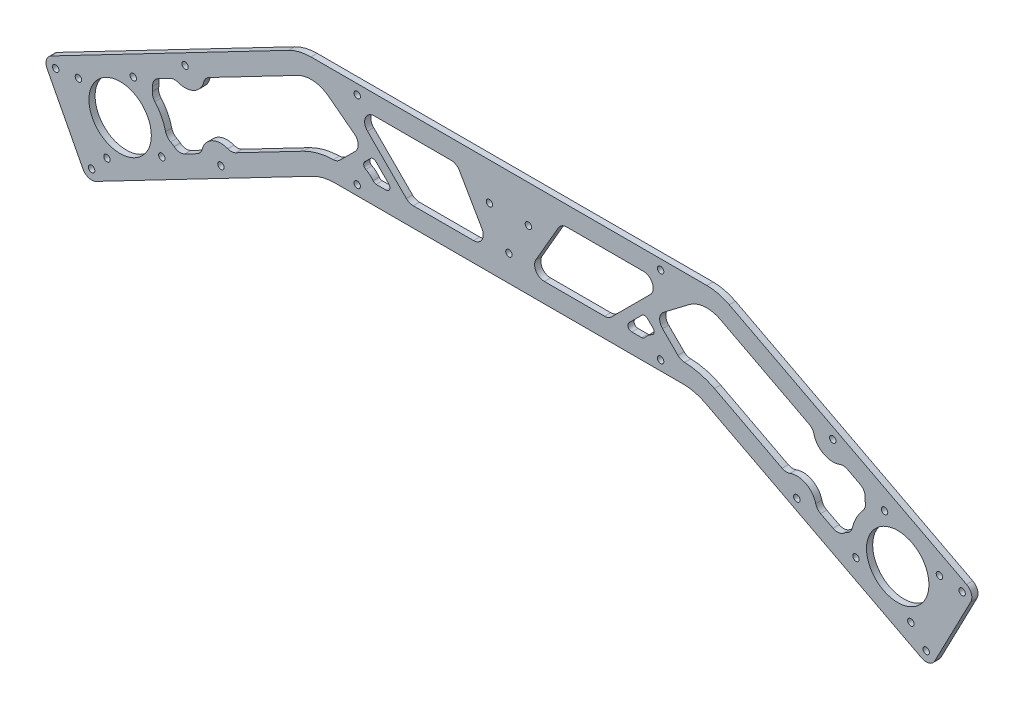
from build123d import *

# Parameters (mm, degrees)
SKETCH1_R              = 16.05
SKETCH1_R_2            = 1.65
BASE_DEPTH             = 3.175
SKETCH3_R              = 1.65
STRUT_HOLES_DEPTH      = 276.893827895
LIGHTENING_HOLES_DEPTH = 276.893827895


with BuildPart() as part:
    # Sketch1 → Base (new body)
    with BuildSketch(Plane.XY):
        with BuildLine():
            Line((-113.35576806, -30.824729171), (-235.437134887, -94.376266227))
            ThreePointArc((-235.437134887, -94.376266227), (-237.896976574, -97.307791395), (-237.563445987, -101.120063459))
            Line((-237.563445987, -101.120063459), (-219.093501457, -136.600496786))
            ThreePointArc((-219.093501457, -136.600496786), (-216.161976289, -139.060338474), (-212.349704225, -138.726807886))
            Line((-212.349704225, -138.726807886), (-101.120845899, -80.824729171))
            ThreePointArc((-101.120845899, -80.824729171), (-95.519277876, -78.716448255), (-89.577130568, -78))
            Line((-89.577130568, -78), (89.577130568, -78))
            ThreePointArc((89.577130568, -78), (95.519277876, -78.716448255), (101.120845899, -80.824729171))
            Line((101.120845899, -80.824729171), (212.349704225, -138.726807886))
            ThreePointArc((212.349704225, -138.726807886), (216.161976289, -139.060338474), (219.093501457, -136.600496786))
            Line((219.093501457, -136.600496786), (237.563445987, -101.120063459))
            ThreePointArc((237.563445987, -101.120063459), (237.896976574, -97.307791395), (235.437134887, -94.376266227))
            Line((235.437134887, -94.376266227), (113.35576806, -30.824729171))
            ThreePointArc((113.35576806, -30.824729171), (107.754200038, -28.716448255), (101.812052729, -28))
            Line((101.812052729, -28), (-101.812052729, -28))
            ThreePointArc((-101.812052729, -28), (-107.754200038, -28.716448255), (-113.35576806, -30.824729171))
        make_face()
        with Locations((-200, -104.11341011)):
            Circle(SKETCH1_R, mode=Mode.SUBTRACT)
        with Locations((-221.458631392, -97.347529622)):
            Circle(SKETCH1_R_2, mode=Mode.SUBTRACT)
        with Locations((-193.234119511, -82.654778719)):
            Circle(SKETCH1_R_2, mode=Mode.SUBTRACT)
        with Locations((-178.541368608, -110.879290599)):
            Circle(SKETCH1_R_2, mode=Mode.SUBTRACT)
        with Locations((-206.765880489, -125.572041502)):
            Circle(SKETCH1_R_2, mode=Mode.SUBTRACT)
        with Locations((206.765880489, -125.572041502)):
            Circle(SKETCH1_R_2, mode=Mode.SUBTRACT)
        with Locations((221.458631392, -97.347529622)):
            Circle(SKETCH1_R_2, mode=Mode.SUBTRACT)
        with Locations((193.234119511, -82.654778719)):
            Circle(SKETCH1_R_2, mode=Mode.SUBTRACT)
        with Locations((178.541368608, -110.879290599)):
            Circle(SKETCH1_R_2, mode=Mode.SUBTRACT)
        with Locations((200, -104.11341011)):
            Circle(SKETCH1_R, mode=Mode.SUBTRACT)
        with Locations((-10, -47.226497308)):
            Circle(SKETCH1_R_2, mode=Mode.SUBTRACT)
        with Locations((10, -47.226497308)):
            Circle(SKETCH1_R_2, mode=Mode.SUBTRACT)
        with Locations((0, -64.547005384)):
            Circle(SKETCH1_R_2, mode=Mode.SUBTRACT)
    extrude(amount=BASE_DEPTH)

    # Sketch3 → Strut Holes (cut, through all)
    with BuildSketch(Plane.XY.offset(3.175)):
        with Locations((-214.658447291, -134.29175372)):
            Circle(SKETCH3_R)
        with Locations((-148.132634803, -99.660607727)):
            Circle(SKETCH3_R)
        with Locations((-78.03119405, -73)):
            Circle(SKETCH3_R)
        with Locations((-78.03119405, -33)):
            Circle(SKETCH3_R)
        with Locations((-166.602579332, -64.1801744)):
            Circle(SKETCH3_R)
        with Locations((-233.128391821, -98.811320393)):
            Circle(SKETCH3_R)
        with Locations((233.128391821, -98.811320393)):
            Circle(SKETCH3_R)
        with Locations((166.602579332, -64.1801744)):
            Circle(SKETCH3_R)
        with Locations((78.03119405, -33)):
            Circle(SKETCH3_R)
        with Locations((78.03119405, -73)):
            Circle(SKETCH3_R)
        with Locations((148.132634803, -99.660607727)):
            Circle(SKETCH3_R)
        with Locations((214.658447291, -134.29175372)):
            Circle(SKETCH3_R)
    extrude(amount=-STRUT_HOLES_DEPTH, mode=Mode.SUBTRACT)

    # Sketch4 → Lightening Holes (cut, through all)
    with BuildSketch(Plane(origin=(0, 0, 0), x_dir=(-1, 0, 0), z_dir=(0, 0, -1))):
        with BuildLine():
            Line((-166.732564066, -103.70620831), (-160.358460468, -100.38806))
            ThreePointArc((-160.358460468, -100.38806), (-158.749015825, -99.059097441), (-157.82234729, -97.188873132))
            ThreePointArc((-157.82234729, -97.188873132), (-152.750120935, -90.790499395), (-144.599570492, -90.305531214))
            ThreePointArc((-144.599570492, -90.305531214), (-142.53605719, -90.619165384), (-140.52429527, -90.063047123))
            Line((-140.52429527, -90.063047123), (-105.738332031, -71.954620839))
            ThreePointArc((-105.738332031, -71.954620839), (-98.269905543, -69.096671797), (-90.347714306, -68.008483875))
            ThreePointArc((-90.347714306, -68.008483875), (-88.493641512, -67.607748759), (-86.922263791, -66.545229763))
            Line((-86.922263791, -66.545229763), (-79.009491694, -58.632457666))
            ThreePointArc((-79.009491694, -58.632457666), (-77.556385787, -54.760066484), (-79.516892411, -51.11817906))
            Line((-79.516892411, -51.11817906), (-92.727653164, -41.063765898))
            ThreePointArc((-92.727653164, -41.063765898), (-100.534196684, -38.054529652), (-108.738281928, -39.694837502))
            Line((-108.738281928, -39.694837502), (-154.376753667, -63.452722127))
            ThreePointArc((-154.376753667, -63.452722127), (-155.986198311, -64.781684686), (-156.912866845, -66.651908996))
            ThreePointArc((-156.912866845, -66.651908996), (-161.9850932, -73.050282732), (-170.135643643, -73.535250914))
            ThreePointArc((-170.135643643, -73.535250914), (-172.199156946, -73.221616743), (-174.210918865, -73.777735004))
            Line((-174.210918865, -73.777735004), (-180.585022463, -77.095883315))
            ThreePointArc((-180.585022463, -77.095883315), (-182.645072259, -79.099137955), (-183.262226102, -81.905551227))
            ThreePointArc((-183.262226102, -81.905551227), (-183.239750678, -82.990325484), (-183.334932996, -84.071149549))
            ThreePointArc((-183.334932996, -84.071149549), (-183.171057415, -86.227404823), (-182.1120053, -88.112796196))
            ThreePointArc((-182.1120053, -88.112796196), (-178.711740004, -93.031443393), (-176.632932149, -98.637997792))
            ThreePointArc((-176.632932149, -98.637997792), (-175.695957289, -100.586938562), (-174.023651545, -101.957954795))
            ThreePointArc((-174.023651545, -101.957954795), (-173.083697968, -102.499921221), (-172.207994291, -103.140532962))
            ThreePointArc((-172.207994291, -103.140532962), (-169.555130221, -104.244682653), (-166.732564066, -103.70620831))
        make_face()
        with BuildLine():
            Line((-68.284399705, -68), (-63.199367137, -68))
            ThreePointArc((-63.199367137, -68), (-61.351608072, -66.765366865), (-61.785153575, -64.585786438))
            Line((-61.785153575, -64.585786438), (-68.424239552, -57.946700461))
            ThreePointArc((-68.424239552, -57.946700461), (-69.838453114, -57.360914023), (-71.252666676, -57.946700461))
            Line((-71.252666676, -57.946700461), (-74.132142401, -60.826176185))
            ThreePointArc((-74.132142401, -60.826176185), (-74.691303243, -62.565648815), (-73.60347304, -64.033658123))
            ThreePointArc((-73.60347304, -64.033658123), (-71.563592326, -65.373065627), (-69.908865429, -67.166666667))
            ThreePointArc((-69.908865429, -67.166666667), (-69.197270634, -67.779513042), (-68.284399705, -68))
        make_face()
        with BuildLine():
            Line((-25.430550415, -40.5), (-13.883545032, -60.5))
            ThreePointArc((-13.883545032, -60.5), (-13.883545032, -65.5), (-18.21367205, -68))
            Line((-18.21367205, -68), (-49.228804389, -68))
            ThreePointArc((-49.228804389, -68), (-51.14222155, -67.619397663), (-52.764338294, -66.535533906))
            Line((-52.764338294, -66.535533906), (-72.764338294, -46.535533906))
            ThreePointArc((-72.764338294, -46.535533906), (-73.848202051, -41.086582838), (-69.228804389, -38))
            Line((-69.228804389, -38), (-29.760677434, -38))
            ThreePointArc((-29.760677434, -38), (-27.260677434, -38.669872981), (-25.430550415, -40.5))
        make_face()
        with BuildLine():
            Line((52.764338294, -66.535533906), (72.764338294, -46.535533906))
            ThreePointArc((72.764338294, -46.535533906), (73.848202051, -41.086582838), (69.228804389, -38))
            Line((69.228804389, -38), (29.760677434, -38))
            ThreePointArc((29.760677434, -38), (27.260677434, -38.669872981), (25.430550415, -40.5))
            Line((25.430550415, -40.5), (13.883545032, -60.5))
            ThreePointArc((13.883545032, -60.5), (13.883545032, -65.5), (18.21367205, -68))
            Line((18.21367205, -68), (49.228804389, -68))
            ThreePointArc((49.228804389, -68), (51.14222155, -67.619397663), (52.764338294, -66.535533906))
        make_face()
        with BuildLine():
            Line((68.284399705, -68), (63.199367137, -68))
            ThreePointArc((63.199367137, -68), (61.351608072, -66.765366865), (61.785153575, -64.585786438))
            Line((61.785153575, -64.585786438), (68.424239552, -57.946700461))
            ThreePointArc((68.424239552, -57.946700461), (69.838453114, -57.360914023), (71.252666676, -57.946700461))
            Line((71.252666676, -57.946700461), (74.132142401, -60.826176185))
            ThreePointArc((74.132142401, -60.826176185), (74.691303243, -62.565648815), (73.60347304, -64.033658123))
            ThreePointArc((73.60347304, -64.033658123), (71.563592326, -65.373065627), (69.908865429, -67.166666667))
            ThreePointArc((69.908865429, -67.166666667), (69.197270634, -67.779513042), (68.284399705, -68))
        make_face()
        with BuildLine():
            Line((154.376753667, -63.452722127), (108.738281928, -39.694837502))
            ThreePointArc((108.738281928, -39.694837502), (100.534196684, -38.054529652), (92.727653164, -41.063765898))
            Line((92.727653164, -41.063765898), (79.516892411, -51.11817906))
            ThreePointArc((79.516892411, -51.11817906), (77.556385787, -54.760066484), (79.009491694, -58.632457666))
            Line((79.009491694, -58.632457666), (86.922263791, -66.545229763))
            ThreePointArc((86.922263791, -66.545229763), (88.493641512, -67.607748759), (90.347714306, -68.008483875))
            ThreePointArc((90.347714306, -68.008483875), (98.269905543, -69.096671797), (105.738332031, -71.954620839))
            Line((105.738332031, -71.954620839), (140.52429527, -90.063047123))
            ThreePointArc((140.52429527, -90.063047123), (142.53605719, -90.619165384), (144.599570492, -90.305531214))
            ThreePointArc((144.599570492, -90.305531214), (152.750120935, -90.790499395), (157.82234729, -97.188873132))
            ThreePointArc((157.82234729, -97.188873132), (158.749015825, -99.059097441), (160.358460468, -100.38806))
            Line((160.358460468, -100.38806), (166.732564066, -103.70620831))
            ThreePointArc((166.732564066, -103.70620831), (169.555130221, -104.244682653), (172.207994291, -103.140532962))
            ThreePointArc((172.207994291, -103.140532962), (173.083697968, -102.499921221), (174.023651545, -101.957954795))
            ThreePointArc((174.023651545, -101.957954795), (175.695957289, -100.586938562), (176.632932149, -98.637997792))
            ThreePointArc((176.632932149, -98.637997792), (178.711740004, -93.031443393), (182.1120053, -88.112796196))
            ThreePointArc((182.1120053, -88.112796196), (183.171057415, -86.227404823), (183.334932996, -84.071149549))
            ThreePointArc((183.334932996, -84.071149549), (183.239750678, -82.990325484), (183.262226102, -81.905551227))
            ThreePointArc((183.262226102, -81.905551227), (182.645072259, -79.099137955), (180.585022463, -77.095883315))
            Line((180.585022463, -77.095883315), (174.210918865, -73.777735004))
            ThreePointArc((174.210918865, -73.777735004), (172.199156946, -73.221616743), (170.135643643, -73.535250914))
            ThreePointArc((170.135643643, -73.535250914), (161.9850932, -73.050282732), (156.912866845, -66.651908996))
            ThreePointArc((156.912866845, -66.651908996), (155.986198311, -64.781684686), (154.376753667, -63.452722127))
        make_face()
    extrude(amount=-LIGHTENING_HOLES_DEPTH, mode=Mode.SUBTRACT)


solid = part.part
